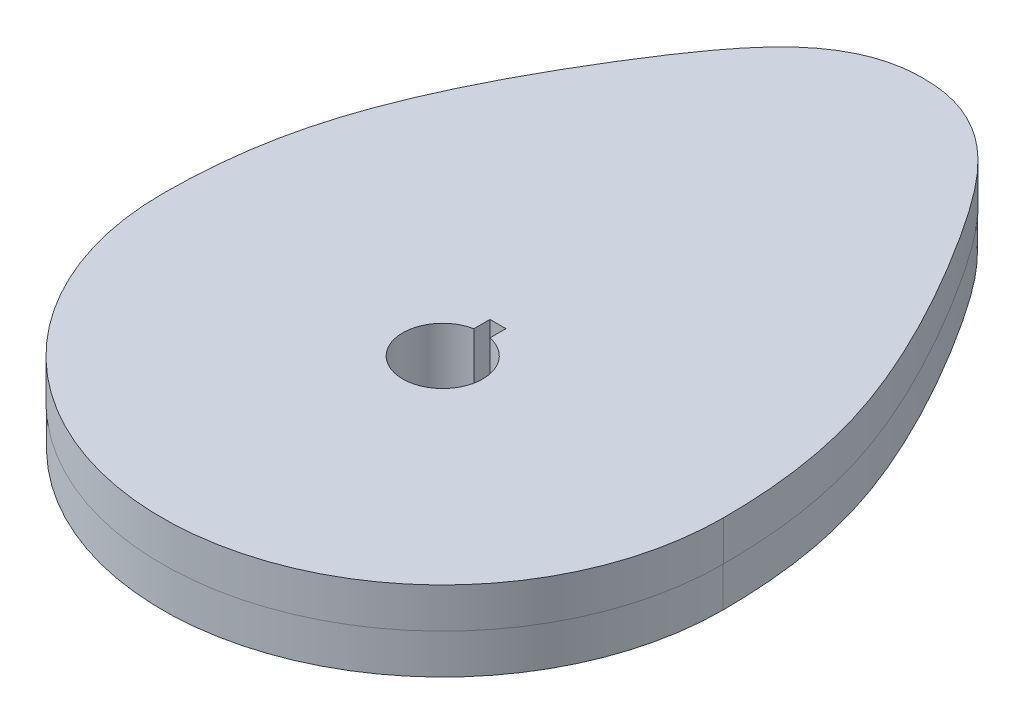
from build123d import *

# Parameters (mm, degrees)
EXTRUDE_1_DEPTH     = 10
EXTRUDE_2_DEPTH     = 10
CUT_EXTRUDE_1_DEPTH = 30


# Read off the part's stored shape, not the designer's step: 凸台-拉伸1
with BuildPart() as part:
    # 凸台-拉伸1 outline → 凸台-拉伸1 (new body)
    # profile 1 of 2: a face of its own
    with BuildSketch(Plane(origin=(0, 0, 0), x_dir=(1, 0, 0), z_dir=(0, 1, 0))):
        with BuildLine():
            add(Edge.make_bspline(
                [(0, 120), (0.054017906, 120), (0.14954637, 120.000010701), (0.440661936, 119.999339429), (0.902530969, 119.995273409), (1.59875714, 119.977571273), (2.671477908, 119.926277407), (4.229753751, 119.791067688), (6.302144906, 119.469677966), (8.461309817, 118.969298201), (11.334941207, 118.069488338), (14.741989907, 116.56188804), (18.315062047, 114.378691569), (21.414914969, 111.997695249), (24.14497147, 109.505480992), (27.418549214, 106.087234143), (31.011260176, 101.689534836), (34.904800652, 96.27876433), (38.62981022, 90.681476765), (42.37198046, 84.7457127), (46.225427103, 78.307777358), (50.183020937, 71.278172239), (54.173611982, 63.640281843), (57.465882708, 56.730135503), (60.059504538, 50.70942498), (61.978091271, 45.855343955), (63.853478362, 40.542212474), (65.649182501, 34.612472474), (67.024679147, 28.999572506), (68.001162869, 23.992946771), (68.654475369, 19.946777857), (69.209362045, 15.574130251), (69.570709729, 11.624645212), (69.785794706, 8.262049573), (69.906340309, 5.628053542), (69.982143004, 2.895524433), (70, 0.95533928), (70, 0)],
                knots=[0, 0, 0, 0, 0.00390625, 0.0078125, 0.015625, 0.0234375, 0.03125, 0.046875, 0.0625, 0.078125, 0.09375, 0.125, 0.15625, 0.1875, 0.21875, 0.25, 0.3125, 0.375, 0.4375, 0.5, 0.5625, 0.625, 0.6875, 0.75, 0.78125, 0.8125, 0.84375, 0.875, 0.90625, 0.921875, 0.9375, 0.953125, 0.96875, 0.9765625, 0.984375, 0.9921875, 1, 1, 1, 1], degree=3))
            add(Edge.make_bspline(
                [(-70, 0), (-70, 0.95533928), (-69.982143004, 2.895524433), (-69.906340309, 5.628053542), (-69.785794706, 8.262049573), (-69.570709729, 11.624645212), (-69.209362045, 15.574130251), (-68.654475369, 19.946777857), (-68.001162869, 23.992946771), (-67.024679147, 28.999572506), (-65.649182501, 34.612472474), (-63.853478362, 40.542212474), (-61.978091271, 45.855343955), (-60.059504538, 50.70942498), (-57.465882708, 56.730135503), (-54.173611982, 63.640281843), (-50.183020937, 71.278172239), (-46.225427103, 78.307777358), (-42.37198046, 84.7457127), (-38.62981022, 90.681476765), (-34.904800652, 96.27876433), (-31.011260176, 101.689534836), (-27.418549214, 106.087234143), (-24.14497147, 109.505480992), (-21.414914969, 111.997695249), (-18.315062047, 114.378691569), (-14.741989907, 116.56188804), (-11.334941207, 118.069488338), (-8.461309817, 118.969298201), (-6.302144906, 119.469677966), (-4.229753751, 119.791067688), (-2.671477908, 119.926277407), (-1.59875714, 119.977571273), (-0.902530969, 119.995273409), (-0.440661936, 119.999339429), (-0.14954637, 120.000010701), (-0.054017906, 120), (0, 120)],
                knots=[0, 0, 0, 0, 0.0078125, 0.015625, 0.0234375, 0.03125, 0.046875, 0.0625, 0.078125, 0.09375, 0.125, 0.15625, 0.1875, 0.21875, 0.25, 0.3125, 0.375, 0.4375, 0.5, 0.5625, 0.625, 0.6875, 0.75, 0.78125, 0.8125, 0.84375, 0.875, 0.90625, 0.921875, 0.9375, 0.953125, 0.96875, 0.9765625, 0.984375, 0.9921875, 0.99609375, 1, 1, 1, 1], degree=3))
            ThreePointArc((-70, 0), (0, -70), (70, 0))
        make_face()
        with BuildLine():
            add(Edge.make_bspline(
                [(60, 0), (60, 0.894386578), (59.98326061, 2.712533562), (59.912459813, 5.262847864), (59.800186065, 7.715694581), (59.600377787, 10.838810988), (59.265831131, 14.493784148), (58.754281298, 18.523902422), (58.153956856, 22.241405693), (57.258563274, 26.831898577), (55.998917521, 31.972304763), (54.34858513, 37.423557813), (52.611460782, 42.346455256), (50.817090437, 46.887328845), (48.369022849, 52.571132419), (45.227460919, 59.167120067), (41.393248441, 66.505788148), (37.578256574, 73.284061368), (32.605602564, 81.584681535), (27.867163451, 88.933994296), (23.042765109, 95.639930505), (19.230002598, 100.290232183), (15.747913728, 103.739369996), (12.626936986, 106.131248469), (10.06946394, 107.687585598), (7.28282287, 108.917950166), (4.859729068, 109.572199014), (3.026770197, 109.856146295), (1.765431127, 109.966092256), (0.880306057, 109.994991347), (0.301237211, 110.000061075), (0.108477107, 110), (0, 110)],
                knots=[0, 0, 0, 0, 0.0078125, 0.015625, 0.0234375, 0.03125, 0.046875, 0.0625, 0.078125, 0.09375, 0.125, 0.15625, 0.1875, 0.21875, 0.25, 0.3125, 0.375, 0.4375, 0.5, 0.625, 0.6875, 0.75, 0.8125, 0.84375, 0.875, 0.90625, 0.9375, 0.953125, 0.96875, 0.984375, 0.9921875, 1, 1, 1, 1], degree=3))
            ThreePointArc((60, 0), (0, -60), (-60, 0))
            add(Edge.make_bspline(
                [(0, 110), (-0.108477107, 110), (-0.301237211, 110.000061075), (-0.880306057, 109.994991347), (-1.765431127, 109.966092256), (-3.026770197, 109.856146295), (-4.859729068, 109.572199014), (-7.28282287, 108.917950166), (-10.06946394, 107.687585598), (-12.626936986, 106.131248469), (-15.747913728, 103.739369996), (-19.230002598, 100.290232183), (-23.042765109, 95.639930505), (-27.867163451, 88.933994296), (-32.605602564, 81.584681535), (-37.578256574, 73.284061368), (-41.393248441, 66.505788148), (-45.227460919, 59.167120067), (-48.369022849, 52.571132419), (-50.817090437, 46.887328845), (-52.611460782, 42.346455256), (-54.34858513, 37.423557813), (-55.998917521, 31.972304763), (-57.258563274, 26.831898577), (-58.153956856, 22.241405693), (-58.754281298, 18.523902422), (-59.265831131, 14.493784148), (-59.600377787, 10.838810988), (-59.800186065, 7.715694581), (-59.912459813, 5.262847864), (-59.98326061, 2.712533562), (-60, 0.894386578), (-60, 0)],
                knots=[0, 0, 0, 0, 0.0078125, 0.015625, 0.03125, 0.046875, 0.0625, 0.09375, 0.125, 0.15625, 0.1875, 0.25, 0.3125, 0.375, 0.5, 0.5625, 0.625, 0.6875, 0.75, 0.78125, 0.8125, 0.84375, 0.875, 0.90625, 0.921875, 0.9375, 0.953125, 0.96875, 0.9765625, 0.984375, 0.9921875, 1, 1, 1, 1], degree=3))
        make_face(mode=Mode.SUBTRACT)
    # profile 2 of 2: a face of its own
    with BuildSketch(Plane(origin=(0, 0, 0), x_dir=(1, 0, 0), z_dir=(0, 1, 0))):
        with BuildLine():
            ThreePointArc((-50, 0), (0, -50), (50, 0))
            add(Edge.make_bspline(
                [(50, 0), (50, 25.226100722), (45.074856711, 37.206868232), (40.936046117, 45.048825147), (37.886396206, 53.544278472), (31.133599973, 65.525045982), (27.430453652, 72.277842215), (22.855978784, 77.941477765), (18.281503917, 84.694273997), (15.885350415, 91.664902367), (9.786050592, 96.457209371), (6.954232817, 100), (2.648237328, 100), (0, 100)],
                knots=[0, 0, 0, 0, 0, 0, 0, 0, 0, 0, 0, 0, 0, 0, 1, 1, 1, 1, 1, 1, 1, 1, 1, 1, 1, 1, 1, 1], degree=13))
            add(Edge.make_bspline(
                [(-50, 0), (-50, 25.226100722), (-45.074856711, 37.206868232), (-40.936046117, 45.048825147), (-37.886396206, 53.544278472), (-31.133599973, 65.525045982), (-27.430453652, 72.277842215), (-22.855978784, 77.941477765), (-18.281503917, 84.694273997), (-15.885350415, 91.664902367), (-9.786050592, 96.457209371), (-6.954232817, 100), (-2.648237328, 100), (0, 100)],
                knots=[0, 0, 0, 0, 0, 0, 0, 0, 0, 0, 0, 0, 0, 0, 1, 1, 1, 1, 1, 1, 1, 1, 1, 1, 1, 1, 1, 1], degree=13))
        make_face()
    extrude(amount=EXTRUDE_1_DEPTH)

    # 草图3 → 凸台-拉伸2 (add)
    with BuildSketch(Plane(origin=(0, 10, 0), x_dir=(1, 0, 0), z_dir=(0, 1, 0))):
        with BuildLine():
            ThreePointArc((-70.1, 0), (0, -70.1), (70.1, 0))
            add(Edge.make_bspline(
                [(70.1, 0), (70.1, 6.199375038), (69.739773957, 12.334620011), (68.547608595, 21.421444604), (68.041420632, 24.431016854), (66.798993454, 30.409205954), (66.062037153, 33.377695143), (64.359448224, 39.273962895), (63.393272451, 42.201644764), (61.790463291, 46.565832278), (61.231208976, 48.015530226), (60.073290484, 50.890213542), (59.474126436, 52.31755552), (57.623557774, 56.573313034), (56.320654044, 59.376240834), (53.600972035, 64.925738095), (52.186354645, 67.673377015), (49.259620936, 73.120401074), (47.747433063, 75.819750799), (44.634845646, 81.174792882), (43.034795999, 83.83008838), (39.763605529, 89.080204798), (38.092297546, 91.67856978), (34.645923468, 96.797746519), (32.871768763, 99.319239487), (29.116226915, 104.207331085), (27.133470486, 106.572906253), (24.403948115, 109.342209708), (23.845276182, 109.886527457), (22.698046619, 110.952825114), (22.10853393, 111.475420017), (20.293746814, 113.000128461), (19.039121476, 113.944487678), (16.424991475, 115.664261859), (15.065150003, 116.439134277), (13.288962179, 117.284678884), (12.929953788, 117.447713591), (12.204127891, 117.761203739), (11.836691341, 117.911868825), (10.732119128, 118.340272477), (9.989961738, 118.595290151), (7.746467089, 119.270205334), (6.2280423, 119.599620559), (3.91679994, 119.91579647), (3.140718807, 119.991180342), (1.968540618, 120.061595236), (1.576450173, 120.077842155), (0.789835127, 120.097446605), (0.395158667, 120.1), (0, 120.1)],
                knots=[0, 0, 0, 0, 0.125, 0.125, 0.1875, 0.1875, 0.25, 0.25, 0.3125, 0.3125, 0.34375, 0.34375, 0.375, 0.375, 0.4375, 0.4375, 0.5, 0.5, 0.5625, 0.5625, 0.625, 0.625, 0.6875, 0.6875, 0.75, 0.75, 0.8125, 0.8125, 0.828125, 0.828125, 0.84375, 0.84375, 0.875, 0.875, 0.90625, 0.90625, 0.9140625, 0.9140625, 0.921875, 0.921875, 0.9375, 0.9375, 0.96875, 0.96875, 0.984375, 0.984375, 0.9921875, 0.9921875, 1, 1, 1, 1], degree=3))
            add(Edge.make_bspline(
                [(0, 120.1), (-0.781071333, 120.1), (-1.559800537, 120.085505819), (-3.107127651, 119.993820301), (-3.876283829, 119.920083778), (-6.169397926, 119.610042284), (-7.679218873, 119.286251151), (-9.914749987, 118.619859368), (-10.658207415, 118.366412348), (-12.114041949, 117.806555421), (-12.827686983, 117.500607396), (-14.928955012, 116.510446674), (-16.27600314, 115.75226235), (-18.224892707, 114.484301993), (-18.862735934, 114.040160458), (-20.116175233, 113.111318823), (-20.730123641, 112.627534308), (-22.521750002, 111.137886861), (-23.656153187, 110.088496888), (-26.920758304, 106.810320209), (-28.9150997, 104.454100442), (-31.755752868, 100.778269694), (-32.678788359, 99.528843), (-34.480097512, 97.006759173), (-35.360117273, 95.733167844), (-37.9570032, 91.886137241), (-39.631628882, 89.287008696), (-44.541976449, 81.420578169), (-47.660912841, 76.082251093), (-51.330191926, 69.269833944), (-52.052395108, 67.900263765), (-53.472024654, 65.146054962), (-54.169268315, 63.762008565), (-56.215395666, 59.59834627), (-57.518610913, 56.80278979), (-59.98020041, 51.164605932), (-61.137033534, 48.321477715), (-63.264003863, 42.574548234), (-64.23326192, 39.670461262), (-65.952840659, 33.791136341), (-66.703580961, 30.81603476), (-67.976082204, 24.791417143), (-68.498659925, 21.742166546), (-69.115734095, 17.114085912), (-69.293736587, 15.561193836), (-69.594367864, 12.45681677), (-69.717326759, 10.90308517), (-70.008810156, 6.237524973), (-70.1, 3.121334285), (-70.1, 0)],
                knots=[0, 0, 0, 0, 0.015625, 0.015625, 0.03125, 0.03125, 0.0625, 0.0625, 0.078125, 0.078125, 0.09375, 0.09375, 0.125, 0.125, 0.140625, 0.140625, 0.15625, 0.15625, 0.1875, 0.1875, 0.25, 0.25, 0.28125, 0.28125, 0.3125, 0.3125, 0.375, 0.375, 0.5, 0.5, 0.53125, 0.53125, 0.5625, 0.5625, 0.625, 0.625, 0.6875, 0.6875, 0.75, 0.75, 0.8125, 0.8125, 0.875, 0.875, 0.90625, 0.90625, 0.9375, 0.9375, 1, 1, 1, 1], degree=3))
        make_face()
    extrude(amount=EXTRUDE_2_DEPTH)

    # 草图4 → 切除-拉伸1 (cut)
    with BuildSketch(Plane.XZ):
        with BuildLine():
            Line((2, -9.797958971), (2, -13.797958971))
            Line((2, -13.797958971), (-2, -13.797958971))
            Line((-2, -13.797958971), (-2, -9.797958971))
            ThreePointArc((-2, -9.797958971), (0, 10), (2, -9.797958971))
        make_face()
    extrude(amount=-CUT_EXTRUDE_1_DEPTH, mode=Mode.SUBTRACT)


solid = part.part
